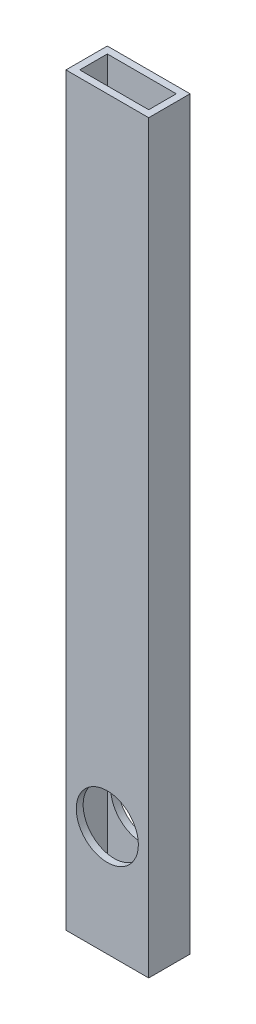
from build123d import *

# Parameters (mm, degrees)
SKETCH1_W           = 38.1
SKETCH1_H           = 19.05
SKETCH1_W_2         = 31.75
SKETCH1_H_2         = 12.7
BOSS_EXTRUDE1_DEPTH = 342.9
SKETCH2_R           = 14.2875
CUT_EXTRUDE1_DEPTH  = 346.535703654


with BuildPart() as part:
    # Sketch1 → Boss-Extrude1 (new body)
    with BuildSketch(Plane(origin=(0, 0, 0), x_dir=(1, 0, 0), z_dir=(0, 1, 0))):
        with Locations((19.05, 9.525)):
            Rectangle(SKETCH1_W, SKETCH1_H)
        with Locations((19.05, 9.525)):
            Rectangle(SKETCH1_W_2, SKETCH1_H_2, mode=Mode.SUBTRACT)
    extrude(amount=BOSS_EXTRUDE1_DEPTH)

    # Sketch2 → Cut-Extrude1 (cut, through all)
    with BuildSketch(Plane.XY):
        with Locations((19.05, 50.8)):
            Circle(SKETCH2_R)
    extrude(amount=-CUT_EXTRUDE1_DEPTH, mode=Mode.SUBTRACT)


solid = part.part
